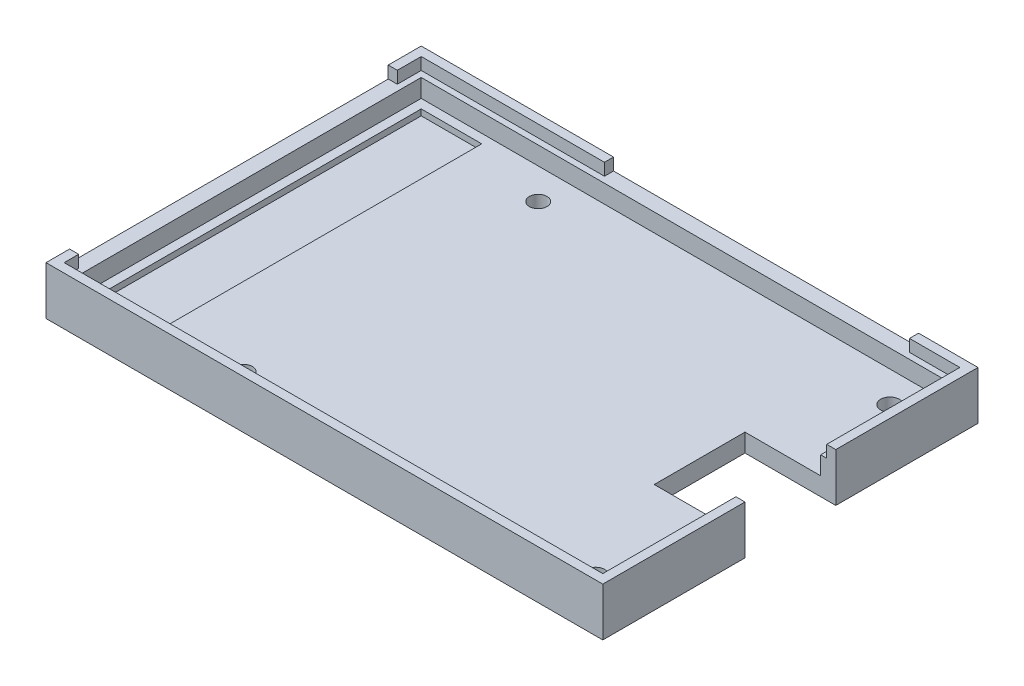
from build123d import *

# Parameters (mm, degrees)
CROQUIS2_W              = 92
CROQUIS2_H              = 62
SALIENTE_EXTRUIR1_DEPTH = 8
CROQUIS3_W              = 89
CROQUIS3_H              = 59
CORTAR_EXTRUIR1_DEPTH   = 2
CROQUIS4_W              = 87
CROQUIS4_H              = 57
CORTAR_EXTRUIR2_DEPTH   = 3
CROQUIS5_W              = 10
CROQUIS5_H              = 53.632525493
CORTAR_EXTRUIR3_DEPTH   = 1
CORTAR_EXTRUIR4_REACH   = 57.696
CROQUIS6_W              = 15
CROQUIS6_H              = 10
CROQUIS7_R              = 5
CORTAR_EXTRUIR5_DEPTH   = 56.794264938
REDONDEO1_R             = 5
CROQUIS9_W              = 2.5
CROQUIS9_H              = 17.009234147
CROQUIS9_H_2            = 13.999979608
CROQUIS9_H_3            = 14.150072655
CROQUIS9_W_2            = 9.965409089
CROQUIS9_H_4            = 2.5
CROQUIS9_W_3            = 7.294458122
CROQUIS9_W_4            = 7.420347284
CROQUIS9_W_5            = 5
CORTAR_EXTRUIR7_DEPTH   = 2
CROQUIS10_R             = 1.492354092
CROQUIS10_R_2           = 1.54105633
CROQUIS10_R_3           = 1.454647155
CROQUIS10_R_4           = 1.436117112
CORTAR_EXTRUIR8_DEPTH   = 56.695601345
CORTAR_EXTRUIR9_REACH   = 99.411
CROQUIS11_W             = 15
CROQUIS11_H             = 8
CROQUIS12_W             = 50.407466657
CROQUIS12_H             = 2
CORTAR_EXTRUIR10_DEPTH  = 2.5
CROQUIS13_W             = 52.657281968
CROQUIS13_H             = 2
CORTAR_EXTRUIR11_DEPTH  = 2.5


with BuildPart() as part:
    # Croquis2 → Saliente-Extruir1 (new body)
    with BuildSketch(Plane(origin=(0, 0, 0), x_dir=(1, 0, 0), z_dir=(0, 1, 0))):
        Rectangle(CROQUIS2_W, CROQUIS2_H)
    extrude(amount=SALIENTE_EXTRUIR1_DEPTH)

    # Croquis3 → Cortar-Extruir1 (cut)
    with BuildSketch(Plane(origin=(0, 8, 0), x_dir=(1, 0, 0), z_dir=(0, 1, 0))):
        Rectangle(CROQUIS3_W, CROQUIS3_H)
    extrude(amount=-CORTAR_EXTRUIR1_DEPTH, mode=Mode.SUBTRACT)

    # Croquis4 → Cortar-Extruir2 (cut)
    with BuildSketch(Plane(origin=(0, 6, 0), x_dir=(1, 0, 0), z_dir=(0, 1, 0))):
        Rectangle(CROQUIS4_W, CROQUIS4_H)
    extrude(amount=-CORTAR_EXTRUIR2_DEPTH, mode=Mode.SUBTRACT)

    # Croquis5 → Cortar-Extruir3 (cut)
    with BuildSketch(Plane(origin=(0, 3, 0), x_dir=(1, 0, 0), z_dir=(0, 1, 0))):
        with Locations((-37, 0.183737253)):
            Rectangle(CROQUIS5_W, CROQUIS5_H)
    extrude(amount=-CORTAR_EXTRUIR3_DEPTH, mode=Mode.SUBTRACT)

    # Cortar-Extruir4: up to this face of the body (flat: up to its plane)
    cortar_extruir4_end = Plane(part.part.faces().sort_by_distance((-37, 2, -0.183737254))[0])
    # Croquis6 → Cortar-Extruir4 (cut, up to the picked face)
    with BuildSketch(Plane(origin=(0, 5, 0), x_dir=(1, 0, 0), z_dir=(0, 1, 0)), mode=Mode.PRIVATE) as cortar_extruir4_sk1:
        with Locations((38.5, 0)):
            Rectangle(CROQUIS6_W, CROQUIS6_H)
    cortar_extruir4_tool1 = split(extrude(cortar_extruir4_sk1.sketch, amount=-CORTAR_EXTRUIR4_REACH, mode=Mode.PRIVATE), bisect_by=cortar_extruir4_end, keep=Keep.BOTH, mode=Mode.PRIVATE)
    add(cortar_extruir4_tool1.solids().sort_by(Axis((38.5, 5, 0), (0, -1, 0)))[0], mode=Mode.SUBTRACT)

    # Croquis7 → Cortar-Extruir5 (cut, through all)
    with BuildSketch(Plane(origin=(0, 2, 0), x_dir=(1, 0, 0), z_dir=(0, 1, 0))):
        with Locations((46, 0)):
            Circle(CROQUIS7_R)
    extrude(amount=-CORTAR_EXTRUIR5_DEPTH, mode=Mode.SUBTRACT)

    # Redondeo1
    # the kernel refuses this fillet: 5 mm, written as the material it takes off along each edge
    with BuildSketch(Plane(origin=(46, 2, 0), x_dir=(0.9999950652018581, 0, -0.00314158748587981), z_dir=(0.00314158748587981, 0, 0.9999950652018581))) as redondeo1_piece_1_section:
        with BuildLine():
            CenterArc((9, -5), REDONDEO1_R, 90, 53.130102354)
            Line((9, 0), (5, 0))
            Line((5, 0), (5, -2))
        make_face()
    redondeo1_piece_1 = revolve(axis=Axis((46, 2, 0), (0, 1, 0)), revolution_arc=359.64, mode=Mode.PRIVATE)
    redondeo1_piece_1 = split(redondeo1_piece_1, bisect_by=Plane(origin=(39.240540113, 1.481080227, 5), z_dir=(0, 0, -1)), keep=Keep.TOP, mode=Mode.PRIVATE)
    redondeo1_piece_1 = split(redondeo1_piece_1, bisect_by=Plane(origin=(39.240540113, 1.481080227, -5), z_dir=(0, 0, 1)), keep=Keep.TOP, mode=Mode.PRIVATE)
    add(redondeo1_piece_1, mode=Mode.SUBTRACT)

    # Croquis9 → Cortar-Extruir7 (cut)
    with BuildSketch(Plane(origin=(0, 8, 0), x_dir=(1, 0, 0), z_dir=(0, 1, 0))):
        with Locations((-44.75, -18.601084438)):
            Rectangle(CROQUIS9_W, CROQUIS9_H)
        with Locations((-44.75, 0.477589339)):
            Rectangle(CROQUIS9_W, CROQUIS9_H_2)
        with Locations((-44.75, 18.476544129)):
            Rectangle(CROQUIS9_W, CROQUIS9_H_3)
        with Locations((31.175863948, 29.75)):
            Rectangle(CROQUIS9_W_2, CROQUIS9_H_4)
        with Locations((16.194930406, 29.75)):
            Rectangle(CROQUIS9_W_3, CROQUIS9_H_4)
        with Locations((2.577919336, 29.75)):
            Rectangle(CROQUIS9_W_4, CROQUIS9_H_4)
        with Locations((-11.725767222, 29.75)):
            Rectangle(CROQUIS9_W_5, CROQUIS9_H_4)
    extrude(amount=-CORTAR_EXTRUIR7_DEPTH, mode=Mode.SUBTRACT)

    # Croquis10 → Cortar-Extruir8 (cut, through all)
    with BuildSketch(Plane(origin=(0, 3, 0), x_dir=(1, 0, 0), z_dir=(0, 1, 0))):
        with Locations(Location((39.042237476, -25.238379945, 0), (0, 0, 270))):
            Circle(CROQUIS10_R)
        with Locations(Location((39.042237476, 23.410831917, 0), (0, 0, 270))):
            Circle(CROQUIS10_R_2)
        with Locations(Location((-19.081524932, 23.410831917, 0), (0, 0, 270))):
            Circle(CROQUIS10_R_3)
        with Locations(Location((-19.081524932, -25.238379945, 0), (0, 0, 270))):
            Circle(CROQUIS10_R_4)
    extrude(amount=-CORTAR_EXTRUIR8_DEPTH, mode=Mode.SUBTRACT)

    # Cortar-Extruir9: up to this face of the body (flat: up to its plane)
    cortar_extruir9_end = Plane(part.part.faces().sort_by_distance((31, 2.5, 0))[0])
    # Croquis11 → Cortar-Extruir9 (cut, up to the picked face)
    with BuildSketch(Plane(origin=(46, 0, 0), x_dir=(0, 0, -1), z_dir=(1, 0, 0)), mode=Mode.PRIVATE) as cortar_extruir9_sk1:
        with Locations((0, 4)):
            Rectangle(CROQUIS11_W, CROQUIS11_H)
    cortar_extruir9_tool1 = split(extrude(cortar_extruir9_sk1.sketch, amount=-CORTAR_EXTRUIR9_REACH, mode=Mode.PRIVATE), bisect_by=cortar_extruir9_end, keep=Keep.BOTH, mode=Mode.PRIVATE)
    add(cortar_extruir9_tool1.solids().sort_by(Axis((46, 4, 0), (-1, 0, 0)))[0], mode=Mode.SUBTRACT)

    # Croquis12 → Cortar-Extruir10 (cut)
    with BuildSketch(Plane(origin=(0, 0, -31), x_dir=(-1, 0, 0), z_dir=(0, 0, -1))):
        with Locations((-10.977966106, 7)):
            Rectangle(CROQUIS12_W, CROQUIS12_H)
    extrude(amount=-CORTAR_EXTRUIR10_DEPTH, mode=Mode.SUBTRACT)

    # Croquis13 → Cortar-Extruir11 (cut)
    with BuildSketch(Plane.ZY.offset(46)):
        with Locations((0.777060527, 7)):
            Rectangle(CROQUIS13_W, CROQUIS13_H)
    extrude(amount=-CORTAR_EXTRUIR11_DEPTH, mode=Mode.SUBTRACT)


solid = part.part
